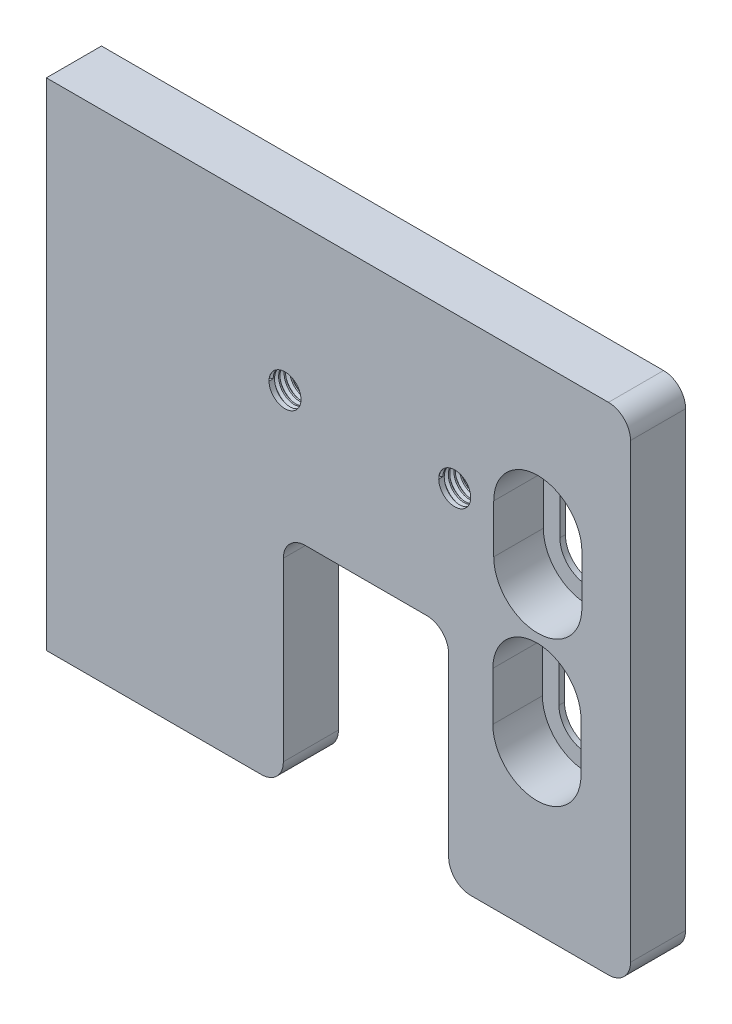
from build123d import *
from build123d.topology import SkipClean

# Parameters (mm, degrees)
BOSS_EXTRUDE1_DEPTH = 5
CUT_EXTRUDE6_DEPTH  = 4.5
CUT_EXTRUDE7_DEPTH  = 57.732425569
SKETCH21_R          = 1.45
CUT_EXTRUDE8_DEPTH  = 4.5
THREAD1_PITCH       = 0.5
THREAD2_PITCH       = 0.5


with BuildPart() as part:
    # Sketch1 → Boss-Extrude1 (new body)
    with BuildSketch(Plane.XY):
        with BuildLine():
            Line((-34.253731343, 0), (-34.253731343, 45))
            Line((-34.253731343, 45), (16.746268657, 45))
            ThreePointArc((16.746268657, 45), (18.160482219, 44.414213562), (18.746268657, 43))
            Line((18.746268657, 43), (18.746268657, 2))
            ThreePointArc((18.746268657, 2), (18.160482219, 0.585786438), (16.746268657, 0))
            Line((16.746268657, 0), (4.246268657, 0))
            ThreePointArc((4.246268657, 0), (2.832055094, 0.585786438), (2.246268657, 2))
            Line((2.246268657, 2), (2.246268657, 18))
            ThreePointArc((2.246268657, 18), (1.660482219, 19.414213562), (0.246268657, 20))
            Line((0.246268657, 20), (-10.753731343, 20))
            ThreePointArc((-10.753731343, 20), (-12.167944906, 19.414213562), (-12.753731343, 18))
            Line((-12.753731343, 18), (-12.753731343, 2))
            ThreePointArc((-12.753731343, 2), (-13.339517781, 0.585786438), (-14.753731343, 0))
            Line((-14.753731343, 0), (-34.253731343, 0))
        make_face()
    extrude(amount=BOSS_EXTRUDE1_DEPTH)

    # Sketch19 → Cut-Extrude6 (cut)
    with BuildSketch(Plane.XY.offset(5)):
        with BuildLine():
            Line((6.337061747, 27.65), (6.337061747, 32.05))
            ThreePointArc((6.337061747, 32.05), (10.337061747, 36.05), (14.337061747, 32.05))
            Line((14.337061747, 32.05), (14.337061747, 27.65))
            ThreePointArc((14.337061747, 27.65), (10.337061747, 23.65), (6.337061747, 27.65))
        make_face()
        with BuildLine():
            Line((6.254695002, 18.85), (6.254695002, 14.45))
            ThreePointArc((6.254695002, 14.45), (10.254262164, 10.450432839), (14.253829325, 14.45))
            Line((14.253829325, 14.45), (14.253829325, 18.766785404))
            ThreePointArc((14.253829325, 18.766785404), (10.296304552, 22.849783575), (6.254695002, 18.85))
        make_face()
    extrude(amount=-CUT_EXTRUDE6_DEPTH, mode=Mode.SUBTRACT)

    # Sketch20 → Cut-Extrude7 (cut, through all)
    with BuildSketch(Plane.XY.offset(0.5)):
        with BuildLine():
            Line((7.837061747, 32.05), (7.837061747, 27.65))
            ThreePointArc((7.837061747, 27.65), (10.337061747, 25.15), (12.837061747, 27.65))
            Line((12.837061747, 27.65), (12.837061747, 32.05))
            ThreePointArc((12.837061747, 32.05), (10.337061747, 34.55), (7.837061747, 32.05))
        make_face()
        with BuildLine():
            Line((12.754695002, 18.85), (12.754262164, 14.45))
            ThreePointArc((12.754262164, 14.45), (10.254262164, 11.95), (7.754262164, 14.45))
            Line((7.754262164, 14.45), (7.754695002, 18.85))
            ThreePointArc((7.754695002, 18.85), (10.254695002, 21.35), (12.754695002, 18.85))
        make_face()
    extrude(amount=-CUT_EXTRUDE7_DEPTH, mode=Mode.SUBTRACT)

    # Sketch21 → Cut-Extrude8 (cut)
    with BuildSketch(Plane.XY.offset(5)):
        with Locations((2.796268657, 31.270849738)):
            Circle(SKETCH21_R)
        with Locations((-12.603731343, 31.270849738)):
            Circle(SKETCH21_R)
    extrude(amount=-CUT_EXTRUDE8_DEPTH, mode=Mode.SUBTRACT)

    # Thread1: the profile of Thread Profile1 profile screwed along a right-hand helix of 9 turns, 6 arcs to a turn; built about Z, then put on its axis
    with SkipClean():  # the faces are left unmerged after this step: merging them gives an invalid solid
        thread1_z = Axis((0, 0, 0), (0, 0, 1))
        thread1_corners = [(1.4497, 0, -0.000173205), (1.720632938, 0, 0.156249999), (1.720632938, 0, 0.218749999), (1.4497, 0, 0.375173204)]
        with BuildLine(mode=Mode.PRIVATE) as thread1_profile:
            Line(thread1_corners[0], thread1_corners[1])
            Line(thread1_corners[1], thread1_corners[2])
            Line(thread1_corners[2], thread1_corners[3])
            Line(thread1_corners[3], thread1_corners[0])
        thread1_cap = Face(thread1_profile.wire())
        thread1_turn_angles = [0, 30, 60, 90, 120, 150, 180, 210, 240, 270, 300, 330, 360]
        thread1_turn_weights = [1, 0.8660254037844387, 1, 0.8660254037844387, 1, 0.8660254037844387, 1, 0.8660254037844387, 1, 0.8660254037844387, 1, 0.8660254037844387, 1]
        thread1_turn_rails = [Edge.make_bspline([Vector(p[0], p[1], 0).rotate(thread1_z, thread1_turn_angles[k]) / thread1_turn_weights[k] + Vector(0, 0, p[2] + THREAD1_PITCH * thread1_turn_angles[k] / 360) for k in range(13)], [0, 0, 0, 1, 1, 2, 2, 3, 3, 4, 4, 5, 5, 6, 6, 6], 2, thread1_turn_weights) for p in thread1_corners]
        thread1_turn_sides = [Face.make_surface_from_curves(thread1_turn_rails[p[0]], thread1_turn_rails[p[1]]) for p in [(0, 1), (1, 2), (2, 3), (3, 0)]]
        thread1 = Plane(origin=(-12.603731343, 31.270849738, 5), x_dir=(-1, 0, 0), z_dir=(0, 0, -1)) * Solid(Shell([*[p.moved(Location((0, 0, THREAD1_PITCH * i))) for i in range(9) for p in thread1_turn_sides], thread1_cap, thread1_cap.rotate(thread1_z, 3240).moved(Location((0, 0, THREAD1_PITCH * 3240 / 360)))]))
        add(thread1, mode=Mode.SUBTRACT)

    # Thread2: the profile of Thread Profile2 profile screwed along a right-hand helix of 9 turns, 6 arcs to a turn; built about Z, then put on its axis
    with SkipClean():  # the faces are left unmerged after this step: merging them gives an invalid solid
        thread2_z = Axis((0, 0, 0), (0, 0, 1))
        thread2_corners = [(1.4497, 0, -0.000173205), (1.720632938, 0, 0.156249999), (1.720632938, 0, 0.218749999), (1.4497, 0, 0.375173204)]
        with BuildLine(mode=Mode.PRIVATE) as thread2_profile:
            Line(thread2_corners[0], thread2_corners[1])
            Line(thread2_corners[1], thread2_corners[2])
            Line(thread2_corners[2], thread2_corners[3])
            Line(thread2_corners[3], thread2_corners[0])
        thread2_cap = Face(thread2_profile.wire())
        thread2_turn_angles = [0, 30, 60, 90, 120, 150, 180, 210, 240, 270, 300, 330, 360]
        thread2_turn_weights = [1, 0.8660254037844387, 1, 0.8660254037844387, 1, 0.8660254037844387, 1, 0.8660254037844387, 1, 0.8660254037844387, 1, 0.8660254037844387, 1]
        thread2_turn_rails = [Edge.make_bspline([Vector(p[0], p[1], 0).rotate(thread2_z, thread2_turn_angles[k]) / thread2_turn_weights[k] + Vector(0, 0, p[2] + THREAD2_PITCH * thread2_turn_angles[k] / 360) for k in range(13)], [0, 0, 0, 1, 1, 2, 2, 3, 3, 4, 4, 5, 5, 6, 6, 6], 2, thread2_turn_weights) for p in thread2_corners]
        thread2_turn_sides = [Face.make_surface_from_curves(thread2_turn_rails[p[0]], thread2_turn_rails[p[1]]) for p in [(0, 1), (1, 2), (2, 3), (3, 0)]]
        thread2 = Plane(origin=(2.796268657, 31.270849738, 5), x_dir=(-1, 0, 0), z_dir=(0, 0, -1)) * Solid(Shell([*[p.moved(Location((0, 0, THREAD2_PITCH * i))) for i in range(9) for p in thread2_turn_sides], thread2_cap, thread2_cap.rotate(thread2_z, 3240).moved(Location((0, 0, THREAD2_PITCH * 3240 / 360)))]))
        add(thread2, mode=Mode.SUBTRACT)


solid = part.part
